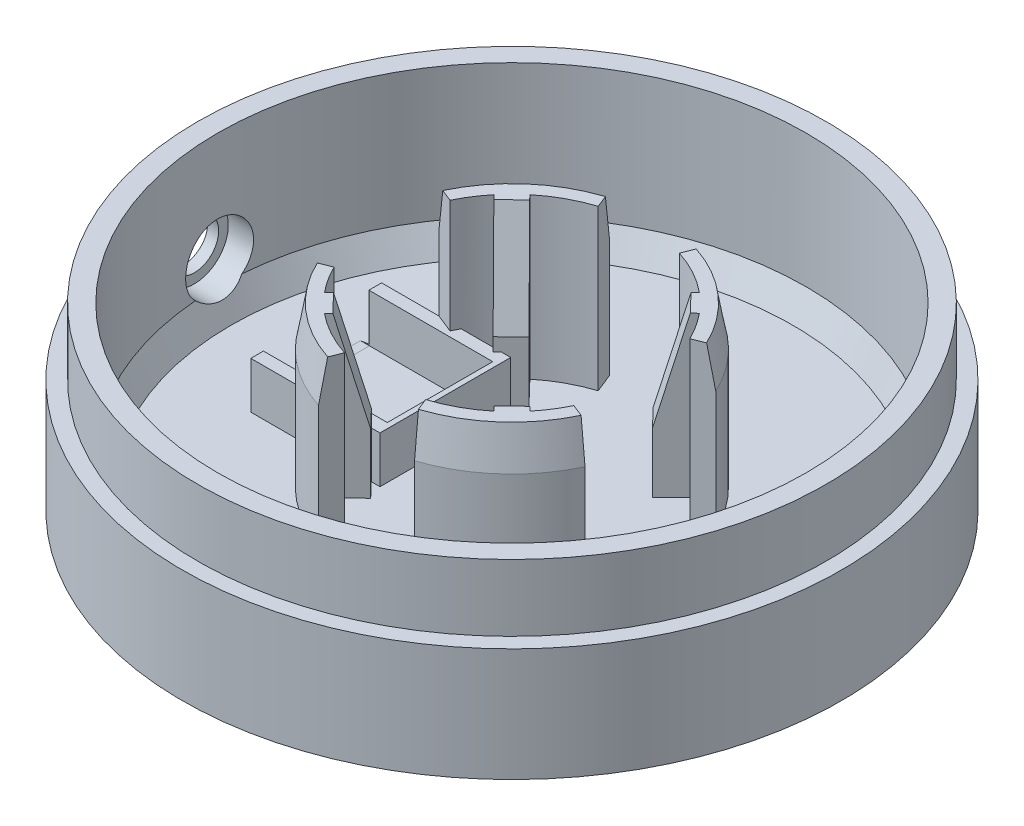
from build123d import *
from OCP.BRepFilletAPI import BRepFilletAPI_MakeChamfer

# Parameters (mm, degrees)
EXTRUDE_1_DEPTH     = 7
OTHER_START         = -47.7
OTHER_1_OUTLINE_R   = 5.1
OTHER_1_DEPTH       = 35.8
OTHER_START_2       = -30.461492928
OTHER_1_2_DEPTH     = 18.561492928
OTHER_START_3       = -51
OTHER_1_3_OUTLINE_R = 3.65
OTHER_1_3_DEPTH     = 3.3
OTHER_START_4       = 2
OTHER_1_4_DEPTH     = 1
OTHER_START_5       = 2.8
OTHER_1_5_DEPTH     = 7.2
OTHER_START_6       = -3
OTHER_1_6_DEPTH     = 0.709959236
EXTRUDE_2_DEPTH     = 24
EXTRUDE_2_2_DEPTH   = 24
EXTRUDE_2_3_DEPTH   = 24
EXTRUDE_2_4_DEPTH   = 24
CHAMFER_1_SIZE      = 6
CHAMFER_1_SIZE2     = 1.057961884
CHAMFER_2_SIZE      = 6
CHAMFER_2_SIZE2     = 1.057961884
CHAMFER_3_SIZE      = 6
CHAMFER_3_SIZE2     = 1.057961884
CHAMFER_4_SIZE      = 6
CHAMFER_4_SIZE2     = 1.057961884
CHAMFER_5_SIZE      = 1.1
EXTRUDE_3_DEPTH     = 24
CHAMFER_6_SIZE      = 15
CHAMFER_6_SIZE2     = 4.019237886


with BuildPart() as part:
    # Эскиз1 → Повернуть1 (revolve)
    with BuildSketch(Plane.XY):
        Polygon((0, 0), (-49.5, 0), (-49.5, 17), (-47.2, 17), (-47.2, 27), (-44.2, 27), (-44.2, 7), (-42.2, 3), (0, 3), align=None)
    revolve(axis=Axis((0, 3, 0), (0, -1, 0)))

    # Эскиз2 → Бобышка-Вытянуть1 (add)
    with BuildSketch(Plane(origin=(0, 3, 0), x_dir=(1, 0, 0), z_dir=(0, 1, 0))):
        Polygon((-10, -9.82), (-10, 9.82), (-29.4, 9.82), (-29.4, 7.82), (-12, 7.82), (-12, -7.82), (-29.4, -7.82), (-29.4, -9.82), align=None)
    extrude(amount=EXTRUDE_1_DEPTH)

    # Отступ1: read off the stored shape, not the designer's step
    # Отступ1 outline → Отступ1 (cut)
    with BuildSketch(Plane.YZ.offset(OTHER_START)):
        with Locations((10.72, 0)):
            Circle(OTHER_1_OUTLINE_R)
    extrude(amount=OTHER_1_DEPTH, mode=Mode.SUBTRACT)

    # Other 1 2 outline → Other 1 2 (cut)
    with BuildSketch(Plane.YZ.offset(OTHER_START_2)):
        with BuildLine():
            Line((2.8, 7.92), (2.8, -7.92))
            Line((2.8, -7.92), (10, -7.92))
            Line((10, -7.92), (10, -5.048920677))
            ThreePointArc((10, -5.048920677), (5.62, 0), (10, 5.048920677))
            Line((10, 5.048920677), (10, 7.92))
            Line((10, 7.92), (2.8, 7.92))
        make_face()
    extrude(amount=OTHER_1_2_DEPTH, mode=Mode.SUBTRACT)

    # Other 1 3 outline → Other 1 3 (cut)
    with BuildSketch(Plane.YZ.offset(OTHER_START_3)):
        with Locations((10.72, 0)):
            Circle(OTHER_1_3_OUTLINE_R)
    extrude(amount=OTHER_1_3_DEPTH, mode=Mode.SUBTRACT)

    # Other 1 4 outline → Other 1 4 (add)
    with BuildSketch(Plane(origin=(0, 0, 0), x_dir=(1, 0, 0), z_dir=(0, 1, 0)).offset(OTHER_START_4)):
        Polygon((-30.461492928, -7.72), (-30.461492928, -7.92), (-29.317348784, -7.92), align=None)
        Polygon((-30.461492928, 7.92), (-30.461492928, 7.72), (-29.317348784, 7.92), align=None)
    extrude(amount=OTHER_1_4_DEPTH)

    # Other 1 5 outline → Other 1 5 (add)
    with BuildSketch(Plane(origin=(0, 0, 0), x_dir=(1, 0, 0), z_dir=(0, 1, 0)).offset(OTHER_START_5)):
        Polygon((-29.317348784, -7.92), (-29.4, -7.905552307), (-29.4, -7.92), align=None)
        Polygon((-29.4, 7.92), (-29.4, 7.905552307), (-29.317348784, 7.92), align=None)
    extrude(amount=OTHER_1_5_DEPTH)

    # Other 1 6 outline → Other 1 6 (add)
    with BuildSketch(Plane(origin=(0, 0, 0), x_dir=(0.9850633751005737, -0.17219218052939098, 0), z_dir=(0.17219218052939098, 0.9850633751005737, 0)).offset(OTHER_START_6)):
        Polygon((-29.361584648, 7.92), (-30.523077576, 7.72), (-30.523077576, -7.72), (-29.361584648, -7.92), align=None)
    extrude(amount=OTHER_1_6_DEPTH)

    # Фаска5
    chamfer_5_edges = [part.edges().sort_by_distance(p)[0] for p in [
        (-11.9, 10, 0),
    ]]
    chamfer(chamfer_5_edges, length=CHAMFER_5_SIZE)



with BuildPart() as body_2:
    # Эскиз4 → Бобышка-Вытянуть2 (new body)
    with BuildSketch(Plane(origin=(0, 3, 0), x_dir=(1, 0, 0), z_dir=(0, 1, 0))):
        with BuildLine():
            Line((-18.006273941, 8.704831921), (-20.798259543, 9.82))
            ThreePointArc((-20.798259543, 9.82), (-15.239680095, 17.226495598), (-7.210659701, 21.84047588))
            Line((-7.210659701, 21.84047588), (-6.095491622, 19.048490278))
            ThreePointArc((-6.095491622, 19.048490278), (-13.113793992, 15.100609496), (-18.006273941, 8.704831921))
        make_face()
    extrude(amount=EXTRUDE_2_DEPTH)

    # Фаска4
    chamfer_4_edges = [body_2.edges().sort_by_distance(p)[0] for p in [
        (-15.239680095, 27, -17.226495598),
    ]]
    chamfer_4_side = [body_2.faces().sort_by_distance(p)[0] for p in [
        (-15.239680095, 15, -17.226495598),
    ]]
    chamfer(chamfer_4_edges, length=CHAMFER_4_SIZE, length2=CHAMFER_4_SIZE2, reference=chamfer_4_side[0])


with BuildPart() as body_3:
    # Эскиз4 → Extrude 2 2 (new body)
    with BuildSketch(Plane(origin=(0, 3, 0), x_dir=(1, 0, 0), z_dir=(0, 1, 0))):
        with BuildLine():
            Line((-18.006273941, -8.704831921), (-20.798259543, -9.82))
            ThreePointArc((-20.798259543, -9.82), (-15.239680095, -17.226495598), (-7.210659701, -21.84047588))
            Line((-7.210659701, -21.84047588), (-6.095491622, -19.048490278))
            ThreePointArc((-6.095491622, -19.048490278), (-13.113793992, -15.100609496), (-18.006273941, -8.704831921))
        make_face()
    extrude(amount=EXTRUDE_2_2_DEPTH)

    # Фаска1
    chamfer_1_edges = [body_3.edges().sort_by_distance(p)[0] for p in [
        (-15.239680095, 27, 17.226495598),
    ]]
    chamfer_1_side = [body_3.faces().sort_by_distance(p)[0] for p in [
        (-15.239680095, 15, 17.226495598),
    ]]
    chamfer(chamfer_1_edges, length=CHAMFER_1_SIZE, length2=CHAMFER_1_SIZE2, reference=chamfer_1_side[0])


with BuildPart() as body_4:
    # Эскиз4 → Extrude 2 3 (new body)
    with BuildSketch(Plane(origin=(0, 3, 0), x_dir=(1, 0, 0), z_dir=(0, 1, 0))):
        with BuildLine():
            Line((6.095491622, 19.048490278), (7.210659701, 21.84047588))
            ThreePointArc((7.210659701, 21.84047588), (15.239680095, 17.226495598), (20.798259543, 9.82))
            Line((20.798259543, 9.82), (18.006273941, 8.704831921))
            ThreePointArc((18.006273941, 8.704831921), (13.113793992, 15.100609496), (6.095491622, 19.048490278))
        make_face()
    extrude(amount=EXTRUDE_2_3_DEPTH)

    # Фаска3
    chamfer_3_edges = [body_4.edges().sort_by_distance(p)[0] for p in [
        (15.239680095, 27, -17.226495598),
    ]]
    chamfer_3_side = [body_4.faces().sort_by_distance(p)[0] for p in [
        (15.239680095, 15, -17.226495598),
    ]]
    chamfer(chamfer_3_edges, length=CHAMFER_3_SIZE, length2=CHAMFER_3_SIZE2, reference=chamfer_3_side[0])


with BuildPart() as body_5:
    # Эскиз4 → Extrude 2 4 (new body)
    with BuildSketch(Plane(origin=(0, 3, 0), x_dir=(1, 0, 0), z_dir=(0, 1, 0))):
        with BuildLine():
            Line((18.006273941, -8.704831921), (20.798259543, -9.82))
            ThreePointArc((20.798259543, -9.82), (15.239680095, -17.226495598), (7.210659701, -21.84047588))
            Line((7.210659701, -21.84047588), (6.095491622, -19.048490278))
            ThreePointArc((6.095491622, -19.048490278), (13.113793992, -15.100609496), (18.006273941, -8.704831921))
        make_face()
    extrude(amount=EXTRUDE_2_4_DEPTH)

    # Фаска2
    chamfer_2_edges = [body_5.edges().sort_by_distance(p)[0] for p in [
        (15.239680095, 27, 17.226495598),
    ]]
    chamfer_2_side = [body_5.faces().sort_by_distance(p)[0] for p in [
        (15.239680095, 15, 17.226495598),
    ]]
    chamfer(chamfer_2_edges, length=CHAMFER_2_SIZE, length2=CHAMFER_2_SIZE2, reference=chamfer_2_side[0])


with BuildPart() as part_1:
    add(part.part)

    add(body_2.part)  # Бобышка-Вытянуть3 merges body 2

    add(body_3.part)  # Бобышка-Вытянуть3 merges body 3

    add(body_4.part)  # Бобышка-Вытянуть3 merges body 4

    add(body_5.part)  # Бобышка-Вытянуть3 merges body 5
    # Эскиз5 → Бобышка-Вытянуть3 (add)
    with BuildSketch(Plane(origin=(0, 3, 0), x_dir=(1, 0, 0), z_dir=(0, 1, 0))):
        with BuildLine():
            Line((-9.275848781, 11.832874951), (-12.730982797, 15.424722916))
            ThreePointArc((-12.730982797, 15.424722916), (-14.142135624, 14.142135624), (-15.424722916, 12.730982797))
            Line((-15.424722916, 12.730982797), (-12.02081528, 9.192388155))
            Line((-12.02081528, 9.192388155), (-9.275848781, 11.832874951))
        make_face()
        with BuildLine():
            ThreePointArc((15.424722916, 12.730982797), (14.142135624, 14.142135624), (12.730982797, 15.424722916))
            Line((12.730982797, 15.424722916), (9.192388155, 12.02081528))
            Line((9.192388155, 12.02081528), (11.832874951, 9.275848781))
            Line((11.832874951, 9.275848781), (15.424722916, 12.730982797))
        make_face()
        with BuildLine():
            ThreePointArc((12.730982797, -15.424722916), (14.142135624, -14.142135624), (15.424722916, -12.730982797))
            Line((15.424722916, -12.730982797), (12.02081528, -9.192388155))
            Line((12.02081528, -9.192388155), (9.275848781, -11.832874951))
            Line((9.275848781, -11.832874951), (12.730982797, -15.424722916))
        make_face()
        with BuildLine():
            ThreePointArc((-15.424722916, -12.730982797), (-14.142135624, -14.142135624), (-12.730982797, -15.424722916))
            Line((-12.730982797, -15.424722916), (-9.192388155, -12.02081528))
            Line((-9.192388155, -12.02081528), (-11.832874951, -9.275848781))
            Line((-11.832874951, -9.275848781), (-15.424722916, -12.730982797))
        make_face()
    extrude(amount=EXTRUDE_3_DEPTH)

    # Фаска6: one chamfer whose edges measure the first distance from different faces: ONE call of the kernel's chamfer builder (chamfer() names one face for all edges)
    chamfer_6_edges_1 = [part_1.edges().sort_by_distance(p)[0] for p in [
        (-10.648332031, 27, -10.512631553),
    ]]
    chamfer_6_side_1 = [part_1.faces().sort_by_distance(p)[0] for p in [
        (-10.570396404, 15.633162389, -10.587600771),
    ]]
    chamfer_6_edges_2 = [part_1.edges().sort_by_distance(p)[0] for p in [
        (10.512631553, 27, -10.648332031),
    ]]
    chamfer_6_side_2 = [part_1.faces().sort_by_distance(p)[0] for p in [
        (10.512631553, 15, -10.648332031),
    ]]
    chamfer_6_edges_3 = [part_1.edges().sort_by_distance(p)[0] for p in [
        (10.648332031, 27, 10.512631553),
    ]]
    chamfer_6_side_3 = [part_1.faces().sort_by_distance(p)[0] for p in [
        (10.648332031, 15, 10.512631553),
    ]]
    chamfer_6_edges_4 = [part_1.edges().sort_by_distance(p)[0] for p in [
        (-10.512631553, 27, 10.648332031),
    ]]
    chamfer_6_side_4 = [part_1.faces().sort_by_distance(p)[0] for p in [
        (-10.447673128, 15.521619556, 10.715860754),
    ]]
    chamfer_6 = BRepFilletAPI_MakeChamfer(part_1.part.solid().wrapped)
    for e in chamfer_6_edges_1:
        chamfer_6.Add(CHAMFER_6_SIZE, CHAMFER_6_SIZE2, e.wrapped, chamfer_6_side_1[0].wrapped)  # the first distance lies on this face
    for e in chamfer_6_edges_2:
        chamfer_6.Add(CHAMFER_6_SIZE, CHAMFER_6_SIZE2, e.wrapped, chamfer_6_side_2[0].wrapped)  # the first distance lies on this face
    for e in chamfer_6_edges_3:
        chamfer_6.Add(CHAMFER_6_SIZE, CHAMFER_6_SIZE2, e.wrapped, chamfer_6_side_3[0].wrapped)  # the first distance lies on this face
    for e in chamfer_6_edges_4:
        chamfer_6.Add(CHAMFER_6_SIZE, CHAMFER_6_SIZE2, e.wrapped, chamfer_6_side_4[0].wrapped)  # the first distance lies on this face
    add(Compound.cast(chamfer_6.Shape()), mode=Mode.REPLACE)


solid = part_1.part
